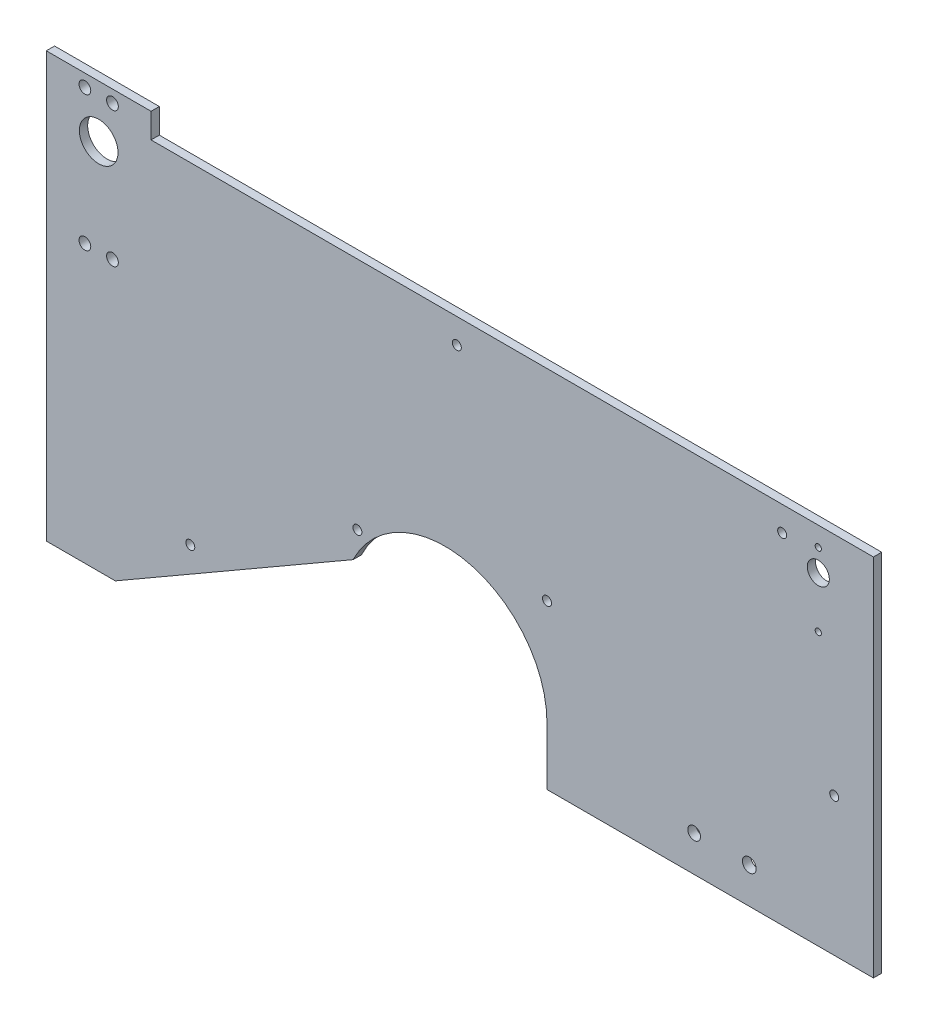
from build123d import *

# Parameters (mm, degrees)
SKETCH2_R           = 7
SKETCH2_R_2         = 2.125
BOSS_EXTRUDE2_DEPTH = 3
SKETCH3_W           = 118.4
SKETCH3_H           = 12.75
CUT_EXTRUDE1_DEPTH  = 338.231374578
SKETCH5_R           = 2.5
SKETCH5_R_2         = 2.306063735
SKETCH5_R_3         = 4
SKETCH5_R_4         = 1.125
SKETCH5_R_5         = 1.625
CUT_EXTRUDE2_DEPTH  = 338.231374578


with BuildPart() as part:
    # Sketch2 → Boss-Extrude2 (new body)
    with BuildSketch(Plane.XY):
        with BuildLine():
            Line((25.03035901, 0), (111.286489227, 49.8))
            ThreePointArc((111.286489227, 49.8), (152.858332199, 69.766604349), (181.6, 33.7))
            Line((181.6, 33.7), (181.6, 0))
            Line((181.6, 0), (300, 0))
            Line((300, 0), (300, 145))
            Line((300, 145), (38, 145))
            Line((38, 145), (38, 154))
            Line((38, 154), (19, 154))
            Line((19, 154), (0, 154))
            Line((0, 154), (0, 0))
            Line((0, 0), (25.03035901, 0))
        make_face()
        with Locations((19, 135)):
            Circle(SKETCH2_R, mode=Mode.SUBTRACT)
        with Locations((14, 149.5)):
            Circle(SKETCH2_R_2, mode=Mode.SUBTRACT)
        with Locations((24, 149.5)):
            Circle(SKETCH2_R_2, mode=Mode.SUBTRACT)
        with Locations((24, 100.5)):
            Circle(SKETCH2_R_2, mode=Mode.SUBTRACT)
        with Locations((14, 100.5)):
            Circle(SKETCH2_R_2, mode=Mode.SUBTRACT)
    extrude(amount=BOSS_EXTRUDE2_DEPTH)

    # Sketch3 → Cut-Extrude1 (cut, through all)
    with BuildSketch(Plane.XY.offset(3)):
        with Locations((240.8, 6.375)):
            Rectangle(SKETCH3_W, SKETCH3_H)
    extrude(amount=-CUT_EXTRUDE1_DEPTH, mode=Mode.SUBTRACT)

    # Sketch5 → Cut-Extrude2 (cut, through all)
    with BuildSketch(Plane.XY.offset(3)):
        with Locations((254.98, 25.75)):
            Circle(SKETCH5_R)
        with Locations((234.98, 25.75)):
            Circle(SKETCH5_R_2)
        with Locations((280, 130)):
            Circle(SKETCH5_R_3)
        with Locations((280, 138)):
            Circle(SKETCH5_R_4)
        with Locations((280, 111.5)):
            Circle(SKETCH5_R_4)
        with Locations((285.78, 62.92)):
            Circle(SKETCH5_R_5)
        with Locations((181.6, 72.03)):
            Circle(SKETCH5_R_5)
        with Locations((52.23, 24.91)):
            Circle(SKETCH5_R_5)
        with Locations((112.84, 59.93)):
            Circle(SKETCH5_R_5)
        with Locations((266.895, 135.995)):
            Circle(SKETCH5_R_5)
        with Locations((148.895, 135.995)):
            Circle(SKETCH5_R_5)
    extrude(amount=-CUT_EXTRUDE2_DEPTH, mode=Mode.SUBTRACT)


solid = part.part
